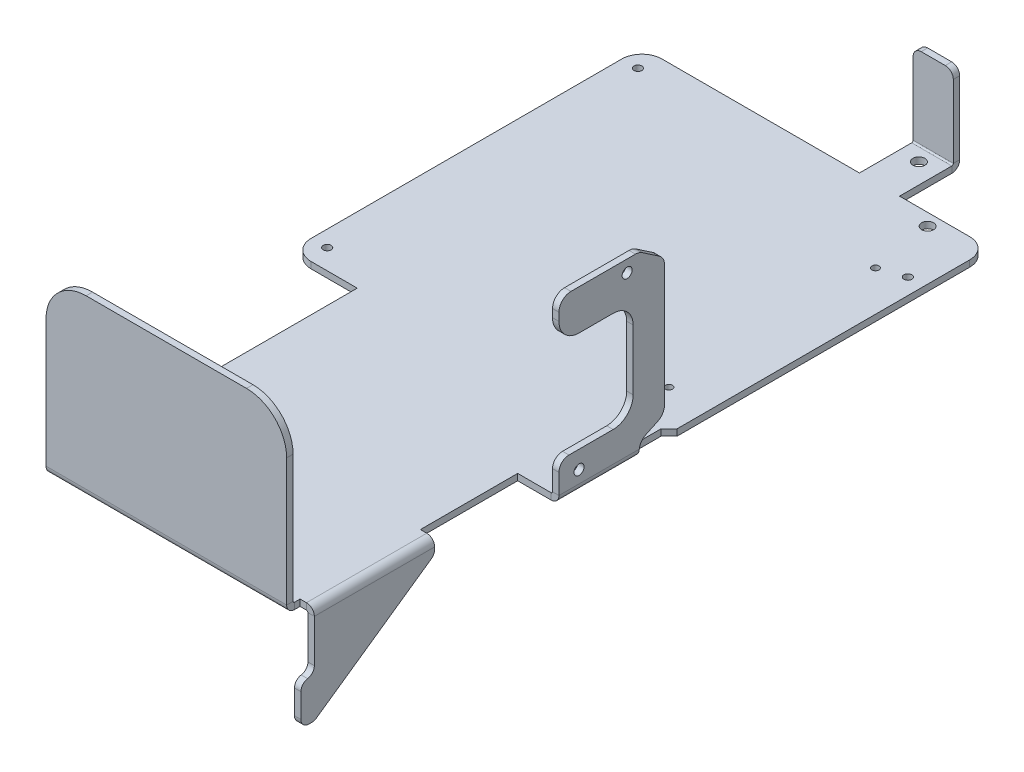
from build123d import *

# Parameters (mm, degrees)
SKETCH1_R                  = 1.98
SKETCH1_R_2                = 3
SKETCH1_R_3                = 1.75
BASE_FLANGE1_DEPTH         = 3.2
CUT_EXTRUDE1_DEPTH         = 369.458014569
SKETCHED_START             = 74.836838233
SKETCHED_BEND1_DEPTH       = 52.633161767
SKETCHED_START_2           = 87.47
SKETCHED_BEND1_2_DEPTH     = 40
SKETCHED_START_3           = 83.64
SKETCHED_BEND1_3_DEPTH     = 3.2
SKETCH9_R                  = 2.5
CUT_EXTRUDE2_DEPTH         = 379.450932148
FILLET1_R                  = 6
SKETCH10_W                 = 60
SKETCH10_H                 = 50.166277303
CUT_EXTRUDE3_DEPTH         = 379.450932148
FILLET2_R                  = 10
SKETCHED_START_4           = 21.74
SKETCHED_BEND2_DEPTH       = 20
SKETCHED_BEND2_2_DEPTH     = 20
FILLET3_R                  = 5
SKETCH13_R                 = 3
CUT_EXTRUDE4_DEPTH         = 359.024009312
SKETCHED_START_5           = -53.74
SKETCHED_BEND3_DEPTH       = 120
SKETCHED_BEND3_2_DEPTH     = 120
FILLET4_R                  = 20
SKETCHED_START_6           = 175.97
SKETCHED_BEND5_DEPTH       = 66.7
SKETCHED_START_7           = 208.025657316
SKETCHED_BEND5_2_DEPTH     = 27.944342684
SKETCHED_START_8           = 235.97
SKETCHED_BEND5_3_OUTLINE_W = 3.2
SKETCHED_BEND5_3_OUTLINE_H = 20
SKETCHED_BEND5_3_DEPTH     = 6.7
SKETCHED_BEND5_4_DEPTH     = 32.055657316
SKETCHED_START_9           = 70.161438651
SKETCHED_BEND5_5_DEPTH     = 3.2
SKETCHED_BEND5_6_DEPTH     = 3.2
FILLET5_R                  = 4
FILLET6_R                  = 4
FILLET7_R                  = 4


with BuildPart() as part:
    # Base-Flange1: sheet metal written as solids
    # Sketch1 → Base-Flange1 (new body)
    with BuildSketch(Plane(origin=(0, 0, 0), x_dir=(1, 0, 0), z_dir=(0, 1, 0))):
        with BuildLine():
            Line((-86.74, 77.47), (-86.74, -77.47))
            ThreePointArc((-86.74, -77.47), (-83.811067812, -84.541067812), (-76.74, -87.47))
            Line((-76.74, -87.47), (-53.74, -87.47))
            Line((-53.74, -87.47), (-53.74, -325.97))
            Line((-53.74, -325.97), (66.26, -325.97))
            Line((66.26, -325.97), (66.26, -235.97))
            Line((66.26, -235.97), (98.26, -235.97))
            Line((98.26, -235.97), (98.26, -242.67))
            Line((98.26, -242.67), (118.26, -242.67))
            Line((118.26, -242.67), (118.26, -235.97))
            Line((118.26, -235.97), (76.26, -175.97))
            Line((76.26, -175.97), (66.26, -175.97))
            Line((66.26, -175.97), (66.26, -127.47))
            Line((66.26, -127.47), (86.74, -127.47))
            Line((86.74, -127.47), (171.74, -127.47))
            Line((171.74, -127.47), (171.74, -87.47))
            Line((171.74, -87.47), (163.151263871, -74.836838233))
            Line((163.151263871, -74.836838233), (95.540712582, -74.836838233))
            Line((95.540712582, -74.836838233), (89.641340328, -87.47))
            Line((89.641340328, -87.47), (86.74, -87.47))
            Line((86.74, -87.47), (86.74, 77.47))
            ThreePointArc((86.74, 77.47), (83.811067812, 84.541067812), (76.74, 87.47))
            Line((76.74, 87.47), (41.74, 87.47))
            Line((41.74, 87.47), (41.74, 157.47))
            Line((41.74, 157.47), (21.74, 157.47))
            Line((21.74, 157.47), (21.74, 87.47))
            Line((21.74, 87.47), (-76.74, 87.47))
            ThreePointArc((-76.74, 87.47), (-83.811067812, 84.541067812), (-86.74, 77.47))
        make_face()
        with Locations(Location((-78.74, 77.47, 0), (0, 0, 270))):
            Circle(SKETCH1_R, mode=Mode.SUBTRACT)
        with Locations(Location((-78.74, -77.47, 0), (0, 0, 270))):
            Circle(SKETCH1_R, mode=Mode.SUBTRACT)
        with Locations(Location((78.74, -77.47, 0), (0, 0, 270))):
            Circle(SKETCH1_R, mode=Mode.SUBTRACT)
        with Locations(Location((78.74, 54.61, 0), (0, 0, 270))):
            Circle(SKETCH1_R, mode=Mode.SUBTRACT)
        with Locations(Location((61.74, 81.47, 0), (0, 0, 270))):
            Circle(SKETCH1_R_2, mode=Mode.SUBTRACT)
        with Locations(Location((66.74, 50.47, 0), (0, 0, 270))):
            Circle(SKETCH1_R_3, mode=Mode.SUBTRACT)
        with Locations(Location((66.74, -52.53, 0), (0, 0, 270))):
            Circle(SKETCH1_R_3, mode=Mode.SUBTRACT)
    extrude(amount=BASE_FLANGE1_DEPTH)

    # Sketch6 → Cut-Extrude1 (cut, through all)
    with BuildSketch(Plane(origin=(0, 3.2, 0), x_dir=(1, 0, 0), z_dir=(0, 1, 0))):
        Polygon((86.74, -68.47), (82.74, -72.47), (82.74, -87.47), (86.74, -87.47), align=None)
    extrude(amount=-CUT_EXTRUDE1_DEPTH, mode=Mode.SUBTRACT)

    # Sketched Bend1: read off the stored shape, not the designer's step
    # Sketched Bend1 outline → Sketched Bend1 (cut)
    with BuildSketch(Plane.XY.offset(SKETCHED_START)):
        with BuildLine():
            Line((171.74, 3.2), (86.770471243, 3.2))
            ThreePointArc((86.770471243, 3.2), (85.413093209, 0.903736739), (82.9034, 0))
            Line((82.9034, 0), (171.74, 0))
            Line((171.74, 0), (171.74, 3.2))
        make_face()
    extrude(amount=SKETCHED_BEND1_DEPTH, mode=Mode.SUBTRACT)

    # Sketched Bend1 2 outline → Sketched Bend1 2 (add)
    with BuildSketch(Plane.XY.offset(SKETCHED_START_2)):
        with BuildLine():
            Line((86.84, 89.102877303), (83.64, 89.102877303))
            Line((83.64, 89.102877303), (83.64, 3.9366))
            ThreePointArc((83.64, 3.9366), (83.424254855, 3.415745145), (82.9034, 3.2))
            Line((82.9034, 3.2), (86.770471243, 3.2))
            ThreePointArc((86.770471243, 3.2), (86.822579265, 3.566662908), (86.84, 3.9366))
            Line((86.84, 3.9366), (86.84, 89.102877303))
        make_face()
    extrude(amount=SKETCHED_BEND1_2_DEPTH)

    # Sketched Bend1 3 outline → Sketched Bend1 3 (add)
    with BuildSketch(Plane.YZ.offset(SKETCHED_START_3)):
        Polygon((12.903589884, 74.836838233), (80.514141174, 74.836838233), (89.102877303, 87.47), (7.004217631, 87.47), align=None)
    extrude(amount=SKETCHED_BEND1_3_DEPTH)

    # Sketch9 → Cut-Extrude2 (cut, through all)
    with BuildSketch(Plane.ZY.offset(-83.64)):
        with Locations(Location((93.47, 83.102877303, 0), (0, 0, 270))):
            Circle(SKETCH9_R)
        with Locations(Location((117.47, 10.102877303, 0), (0, 0, 270))):
            Circle(SKETCH9_R)
    extrude(amount=-CUT_EXTRUDE2_DEPTH, mode=Mode.SUBTRACT)

    # Fillet1
    fillet1_edges = [part.edges().sort_by_distance(p)[0] for p in [
        (85.24, 7.004217631, 87.47),
        (85.24, 12.903589884, 74.836838233),
        (85.24, 80.514141174, 74.836838233),
        (85.24, 89.102877303, 87.47),
        (85.24, 89.102877303, 127.47),
    ]]
    fillet(fillet1_edges, radius=FILLET1_R)

    # Sketch10 → Cut-Extrude3 (cut, through all)
    with BuildSketch(Plane.ZY.offset(-83.64)):
        with Locations((120.47, 44.019738651)):
            Rectangle(SKETCH10_W, SKETCH10_H)
    extrude(amount=-CUT_EXTRUDE3_DEPTH, mode=Mode.SUBTRACT)

    # Fillet2
    fillet2_edges = [part.edges().sort_by_distance(p)[0] for p in [
        (85.24, 18.9366, 90.47),
        (85.24, 69.102877303, 127.47),
        (85.24, 69.102877303, 90.47),
    ]]
    fillet(fillet2_edges, radius=FILLET2_R)

    # Sketched Bend2: read off the stored shape, not the designer's step
    # Sketched Bend2 outline → Sketched Bend2 (cut)
    with BuildSketch(Plane.YZ.offset(SKETCHED_START_4)):
        with BuildLine():
            Line((3.2, -157.47), (3.2, -117.400471243))
            ThreePointArc((3.2, -117.400471243), (0.903736739, -116.043093209), (0, -113.5334))
            Line((0, -113.5334), (0, -157.47))
            Line((0, -157.47), (3.2, -157.47))
        make_face()
    extrude(amount=SKETCHED_BEND2_DEPTH, mode=Mode.SUBTRACT)

    # Sketched Bend2 2 outline → Sketched Bend2 2 (add)
    with BuildSketch(Plane.YZ.offset(SKETCHED_START_4)):
        with BuildLine():
            Line((44.202877303, -114.27), (3.9366, -114.27))
            ThreePointArc((3.9366, -114.27), (3.415745145, -114.054254855), (3.2, -113.5334))
            Line((3.2, -113.5334), (3.2, -117.400471243))
            ThreePointArc((3.2, -117.400471243), (3.566662908, -117.452579265), (3.9366, -117.47))
            Line((3.9366, -117.47), (44.202877303, -117.47))
            Line((44.202877303, -117.47), (44.202877303, -114.27))
        make_face()
    extrude(amount=SKETCHED_BEND2_2_DEPTH)

    # Fillet3
    fillet3_edges = [part.edges().sort_by_distance(p)[0] for p in [
        (85.24, 18.9366, 127.47),
    ]]
    fillet(fillet3_edges, radius=FILLET3_R)

    # Sketch13 → Cut-Extrude4 (cut, through all)
    with BuildSketch(Plane.XZ):
        with Locations(Location((31.74, -107.13, 0), (0, 0, 270))):
            Circle(SKETCH13_R)
    extrude(amount=-CUT_EXTRUDE4_DEPTH, mode=Mode.SUBTRACT)

    # Sketched Bend3: read off the stored shape, not the designer's step
    # Sketched Bend3 outline → Sketched Bend3 (cut)
    with BuildSketch(Plane.YZ.offset(SKETCHED_START_5)):
        with BuildLine():
            ThreePointArc((0, 238.7334), (0.903736739, 241.243093209), (3.2, 242.600471243))
            Line((3.2, 242.600471243), (3.2, 325.97))
            Line((3.2, 325.97), (0, 325.97))
            Line((0, 325.97), (0, 238.7334))
        make_face()
    extrude(amount=SKETCHED_BEND3_DEPTH, mode=Mode.SUBTRACT)

    # Sketched Bend3 2 outline → Sketched Bend3 2 (add)
    with BuildSketch(Plane.YZ.offset(SKETCHED_START_5)):
        with BuildLine():
            Line((87.502877303, 242.67), (3.9366, 242.67))
            ThreePointArc((3.9366, 242.67), (3.566662908, 242.652579265), (3.2, 242.600471243))
            Line((3.2, 242.600471243), (3.2, 238.7334))
            ThreePointArc((3.2, 238.7334), (3.415745145, 239.254254855), (3.9366, 239.47))
            Line((3.9366, 239.47), (87.502877303, 239.47))
            Line((87.502877303, 239.47), (87.502877303, 242.67))
        make_face()
    extrude(amount=SKETCHED_BEND3_2_DEPTH)

    # Fillet4
    fillet4_edges = [part.edges().sort_by_distance(p)[0] for p in [
        (-53.74, 87.502877303, 241.07),
        (66.26, 87.502877303, 241.07),
    ]]
    fillet(fillet4_edges, radius=FILLET4_R)

    # Sketched Bend5: read off the stored shape, not the designer's step
    # Sketched Bend5 outline → Sketched Bend5 (cut)
    with BuildSketch(Plane.XY.offset(SKETCHED_START_6)):
        with BuildLine():
            ThreePointArc((69.424838651, 3.2), (71.93453186, 2.296263261), (73.291909894, 0))
            Line((73.291909894, 0), (118.26, 0))
            Line((118.26, 0), (118.26, 3.2))
            Line((118.26, 3.2), (69.424838651, 3.2))
        make_face()
    extrude(amount=SKETCHED_BEND5_DEPTH, mode=Mode.SUBTRACT)

    # Sketched Bend5 2 outline → Sketched Bend5 2 (add)
    with BuildSketch(Plane.XY.offset(SKETCHED_START_7)):
        with BuildLine():
            ThreePointArc((73.361438651, -0.7366), (73.344017916, -0.366662908), (73.291909894, 0))
            Line((73.291909894, 0), (69.424838651, 0))
            ThreePointArc((69.424838651, 0), (69.945693506, -0.215745145), (70.161438651, -0.7366))
            Line((70.161438651, -0.7366), (70.161438651, -25.901438651))
            Line((70.161438651, -25.901438651), (73.361438651, -25.901438651))
            Line((73.361438651, -25.901438651), (73.361438651, -0.7366))
        make_face()
    extrude(amount=SKETCHED_BEND5_2_DEPTH)

    # Sketched Bend5 3 outline → Sketched Bend5 3 (add)
    with BuildSketch(Plane.XY.offset(SKETCHED_START_8)):
        with Locations((71.761438651, -35.901438651)):
            Rectangle(SKETCHED_BEND5_3_OUTLINE_W, SKETCHED_BEND5_3_OUTLINE_H)
    extrude(amount=SKETCHED_BEND5_3_DEPTH)

    # Sketched Bend5 4 outline → Sketched Bend5 4 (add)
    with BuildSketch(Plane.XY.offset(SKETCHED_START_6)):
        with BuildLine():
            ThreePointArc((73.361438651, -0.7366), (73.344017916, -0.366662908), (73.291909894, 0))
            Line((73.291909894, 0), (69.424838651, 0))
            ThreePointArc((69.424838651, 0), (69.945693506, -0.215745145), (70.161438651, -0.7366))
            Line((70.161438651, -0.7366), (70.161438651, -25.901438651))
            Line((70.161438651, -25.901438651), (73.361438651, -25.901438651))
            Line((73.361438651, -25.901438651), (73.361438651, -0.7366))
        make_face()
    extrude(amount=SKETCHED_BEND5_4_DEPTH)

    # Sketched Bend5 5 outline → Sketched Bend5 5 (cut)
    with BuildSketch(Plane.YZ.offset(SKETCHED_START_9)):
        Polygon((-3.901438651, 175.97), (-25.901438651, 207.398571429), (-25.901438651, 175.97), align=None)
    extrude(amount=SKETCHED_BEND5_5_DEPTH, mode=Mode.SUBTRACT)

    # Sketched Bend5 6 outline → Sketched Bend5 6 (add)
    with BuildSketch(Plane.YZ.offset(SKETCHED_START_9)):
        Polygon((-25.901438651, 235.97), (-45.901438651, 235.97), (-25.901438651, 207.398571429), align=None)
    extrude(amount=SKETCHED_BEND5_6_DEPTH)

    # Fillet5
    fillet5_edges = [part.edges().sort_by_distance(p)[0] for p in [
        (41.74, 44.202877303, -115.87),
        (21.74, 44.202877303, -115.87),
    ]]
    fillet(fillet5_edges, radius=FILLET5_R)

    # Fillet6
    fillet6_edges = [part.edges().sort_by_distance(p)[0] for p in [
        (71.761438651, -45.901438651, 235.97),
        (71.761438651, -45.901438651, 242.67),
        (71.761438651, -25.901438651, 242.67),
        (71.761438651, -3.901438651, 175.97),
    ]]
    fillet(fillet6_edges, radius=FILLET6_R)

    # Fillet7
    fillet7_edges = [part.edges().sort_by_distance(p)[0] for p in [
        (71.761438651, -25.901438651, 235.97),
    ]]
    fillet(fillet7_edges, radius=FILLET7_R)


solid = part.part
